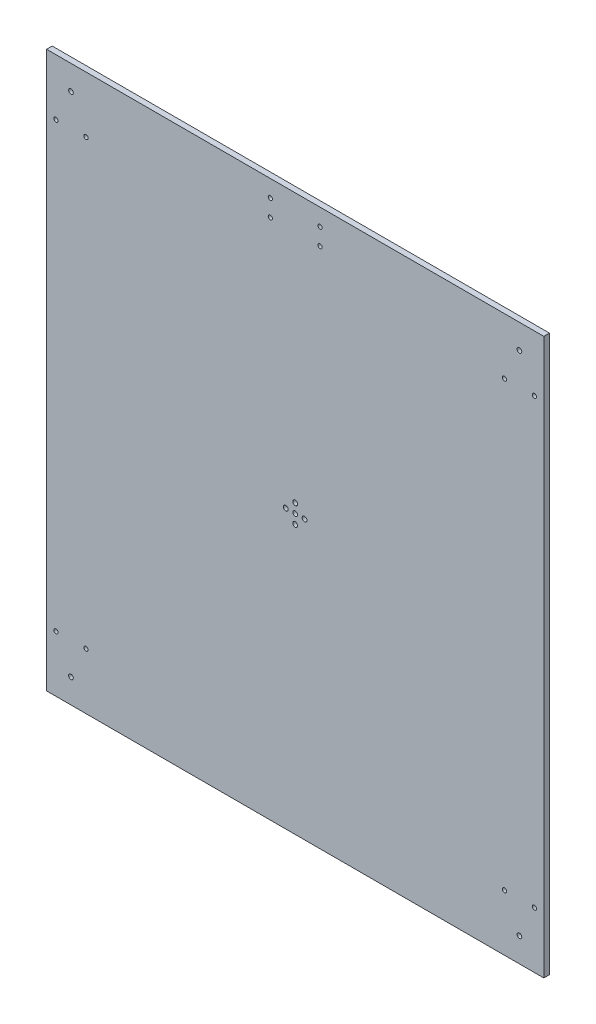
from build123d import *

# Parameters (mm, degrees)
SKETCH_3_W                  = 530
SKETCH_3_H                  = 592.3
SKETCH_3_R                  = 2.55
EXTRUDE_1_DEPTH             = 6
SKETCH_4_R                  = 2.5
CUT_EXTRUDE_1_DEPTH         = 398.449144546
PATTERN_LINEAR_1_COUNT      = 2
PATTERN_LINEAR_1_PITCH      = 478
PATTERN_LINEAR_1_COUNT_DIR2 = 2
PATTERN_LINEAR_1_PITCH_DIR2 = 540.3
SKETCH_7_R                  = 2.25
CUT_EXTRUDE_2_DEPTH         = 398.449144546
SKETCH_8_R                  = 2.25
CUT_EXTRUDE_3_DEPTH         = 398.449144546
PATTERN_LINEAR_2_COUNT      = 2
PATTERN_LINEAR_2_PITCH      = 472.3
PATTERN_LINEAR_2_COUNT_DIR2 = 2
PATTERN_LINEAR_2_PITCH_DIR2 = 478


with BuildPart() as part:
    # Эскиз3 → Бобышка-Вытянуть1 (new body)
    with BuildSketch(Plane.XY):
        Rectangle(SKETCH_3_W, SKETCH_3_H)
        Circle(SKETCH_3_R, mode=Mode.SUBTRACT)
        with Locations((0, 10)):
            Circle(SKETCH_3_R, mode=Mode.SUBTRACT)
        with Locations((10, 0)):
            Circle(SKETCH_3_R, mode=Mode.SUBTRACT)
        with Locations((0, -10)):
            Circle(SKETCH_3_R, mode=Mode.SUBTRACT)
        with Locations((-10, 0)):
            Circle(SKETCH_3_R, mode=Mode.SUBTRACT)
    extrude(amount=EXTRUDE_1_DEPTH)

    # Эскиз4 → Вырез-Вытянуть1 (cut, through all)
    with BuildSketch(Plane.XY.offset(6)):
        with Locations((-239, 270.15)):
            Circle(SKETCH_4_R)
    cut_extrude_1 = extrude(amount=-CUT_EXTRUDE_1_DEPTH, mode=Mode.SUBTRACT)

    # Линейный массив1: Cut-Extrude 1 2 × 2
    with Locations(*[(i * PATTERN_LINEAR_1_PITCH, -j * PATTERN_LINEAR_1_PITCH_DIR2, 0) for i in range(PATTERN_LINEAR_1_COUNT) for j in range(PATTERN_LINEAR_1_COUNT_DIR2) if (i, j) != (0, 0)]):
        add(cut_extrude_1, mode=Mode.SUBTRACT)

    # Эскиз7 → Вырез-Вытянуть2 (cut, through all)
    with BuildSketch(Plane(origin=(0, 0, 0), x_dir=(-1, 0, 0), z_dir=(0, 0, -1))):
        with Locations((-26.5, 278.15)):
            Circle(SKETCH_7_R)
        with Locations((26.5, 278.15)):
            Circle(SKETCH_7_R)
        with Locations((-26.5, 260.15)):
            Circle(SKETCH_7_R)
        with Locations((26.5, 260.15)):
            Circle(SKETCH_7_R)
    extrude(amount=-CUT_EXTRUDE_2_DEPTH, mode=Mode.SUBTRACT)

    # Эскиз8 → Вырез-Вытянуть3 (cut, through all)
    with BuildSketch(Plane(origin=(0, 0, 0), x_dir=(-1, 0, 0), z_dir=(0, 0, -1))):
        with Locations((223, 236.15)):
            Circle(SKETCH_8_R)
        with Locations((255, 236.15)):
            Circle(SKETCH_8_R)
    cut_extrude_3 = extrude(amount=-CUT_EXTRUDE_3_DEPTH, mode=Mode.SUBTRACT)

    # Линейный массив2: Cut-Extrude 3 2 × 2
    with Locations(*[(j * PATTERN_LINEAR_2_PITCH_DIR2, -i * PATTERN_LINEAR_2_PITCH, 0) for i in range(PATTERN_LINEAR_2_COUNT) for j in range(PATTERN_LINEAR_2_COUNT_DIR2) if (i, j) != (0, 0)]):
        add(cut_extrude_3, mode=Mode.SUBTRACT)


solid = part.part
